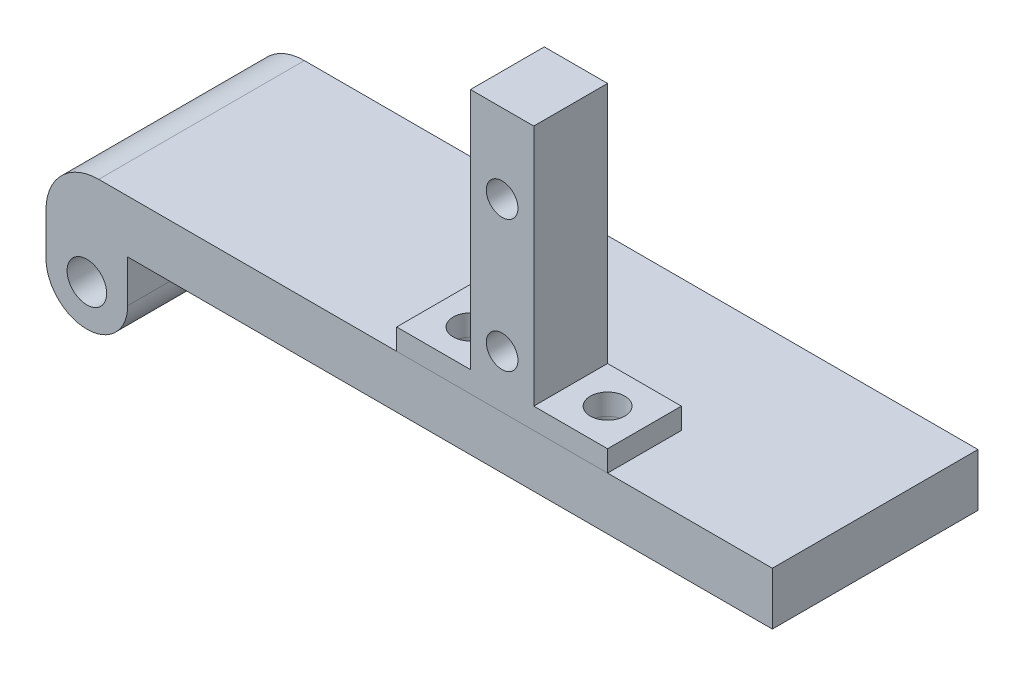
from build123d import *

# Parameters (mm, degrees)
SKETCH1_R               = 2.38125
BOSS_EXTRUDE1_DEPTH     = 38.1
FILLET1_R               = 6.35
SKETCH3_W               = 38.1
SKETCH3_H               = 6.35
BOSS_EXTRUDE2_DEPTH     = 12.7
SKETCH2_W               = 7.62
SKETCH2_H               = 8.89
BOSS_EXTRUDE3_DEPTH     = 31.75
CUT_EXTRUDE1_DEPTH      = 66.891051605
CUT_EXTRUDE1_DEPTH_BACK = 66.891051605
SKETCH5_R               = 1.905
SKETCH6_W               = 25.4
SKETCH6_H               = 8.89
BOSS_EXTRUDE4_DEPTH     = 2.54
CUT_EXTRUDE2_DEPTH      = 70.378699409
CUT_EXTRUDE2_DEPTH_BACK = 70.378699409
SKETCH7_R               = 2.0828
CUT_EXTRUDE3_DEPTH      = 13.335


# Read off the part's stored shape, not the designer's step: Split1
with BuildPart() as part:
    # Sketch1 → Boss-Extrude1 (new body)
    with BuildSketch(Plane.XY):
        with BuildLine():
            Line((-37.385625, -8.255), (-37.385625, -3.175))
            Line((-37.385625, -3.175), (-37.385625, 3.175))
            Line((-37.385625, 3.175), (37.385625, 3.175))
            Line((37.385625, 3.175), (37.385625, -3.175))
            Line((37.385625, -3.175), (-27.543125, -3.175))
            Line((-27.543125, -3.175), (-27.543125, -8.255))
            ThreePointArc((-27.543125, -8.255), (-32.464375, -13.17625), (-37.385625, -8.255))
        make_face()
        with Locations(Location((-32.464375, -8.255, 0), (0, 0, 180))):
            Circle(SKETCH1_R, mode=Mode.SUBTRACT)
    extrude(amount=BOSS_EXTRUDE1_DEPTH)

    # Fillet1
    fillet1_edges = [part.edges().sort_by_distance(p)[0] for p in [
        (-37.385625, 3.175, 19.05),
    ]]
    fillet(fillet1_edges, radius=FILLET1_R)

    # Sketch3 → Boss-Extrude2 (add)
    with BuildSketch(Plane(origin=(37.385625, 0, 0), x_dir=(0, 0, -1), z_dir=(1, 0, 0))):
        with Locations((-19.05, 0)):
            Rectangle(SKETCH3_W, SKETCH3_H)
    extrude(amount=BOSS_EXTRUDE2_DEPTH)

    # Sketch2 → Boss-Extrude3 (add)
    with BuildSketch(Plane(origin=(0, 3.175, 0), x_dir=(1, 0, 0), z_dir=(0, 1, 0))):
        with Locations((17.541875, -20.32)):
            Rectangle(SKETCH2_W, SKETCH2_H)
    extrude(amount=BOSS_EXTRUDE3_DEPTH)

    # Sketch5 → Cut-Extrude1 (cut, two sides: drawn at the far end of the back side and taken through both)
    with BuildSketch(Plane.XY.offset(24.765).offset(-CUT_EXTRUDE1_DEPTH_BACK)):
        with Locations((17.541875, 9.525)):
            Circle(SKETCH5_R)
        with Locations((17.541875, 25.4)):
            Circle(SKETCH5_R)
    extrude(amount=CUT_EXTRUDE1_DEPTH + CUT_EXTRUDE1_DEPTH_BACK, mode=Mode.SUBTRACT)

    # Sketch6 → Boss-Extrude4 (add)
    with BuildSketch(Plane(origin=(0, 3.175, 0), x_dir=(1, 0, 0), z_dir=(0, 1, 0))):
        with Locations((17.541875, -20.32)):
            Rectangle(SKETCH6_W, SKETCH6_H)
    extrude(amount=BOSS_EXTRUDE4_DEPTH)

    # Sketch7 → Cut-Extrude2 (cut, two sides: drawn at the far end of the back side and taken through both)
    with BuildSketch(Plane(origin=(0, 5.715, 0), x_dir=(1, 0, 0), z_dir=(0, 1, 0)).offset(-CUT_EXTRUDE2_DEPTH_BACK)):
        with Locations(Location((9.286875, -20.32, 0), (0, 0, 270))):
            Circle(SKETCH7_R)
        with Locations(Location((25.796875, -20.32, 0), (0, 0, 270))):
            Circle(SKETCH7_R)
    extrude(amount=CUT_EXTRUDE2_DEPTH + CUT_EXTRUDE2_DEPTH_BACK, mode=Mode.SUBTRACT)

    # Sketch9 → Cut-Extrude3 (cut)
    with BuildSketch(Plane.XY.offset(38.1)):
        with BuildLine():
            Line((50.085625, 3.175), (50.085625, -3.175))
            Line((50.085625, -3.175), (-27.543125, -3.175))
            Line((-27.543125, -3.175), (-27.543125, -8.255))
            ThreePointArc((-27.543125, -8.255), (-32.464375, -13.17625), (-37.385625, -8.255))
            Line((-37.385625, -8.255), (-37.385625, -3.175))
            ThreePointArc((-37.385625, -3.175), (-35.525753061, 1.315128061), (-31.035625, 3.175))
            Line((-31.035625, 3.175), (50.085625, 3.175))
        make_face()
    extrude(amount=-CUT_EXTRUDE3_DEPTH, mode=Mode.SUBTRACT)


with BuildPart() as body_2:
    # Split1: the piece on the far side of the plane
    add(part.part)
    split(bisect_by=Plane(origin=(0, 3.175, 0), x_dir=(1, 0, 0), z_dir=(0, 1, 0)), keep=Keep.BOTTOM)


with BuildPart() as part_1:
    add(part.part)

    # Split1
    split(bisect_by=Plane(origin=(0, 3.175, 0), x_dir=(1, 0, 0), z_dir=(0, 1, 0)), keep=Keep.TOP)


solid = Compound([body_2.part, part_1.part])
